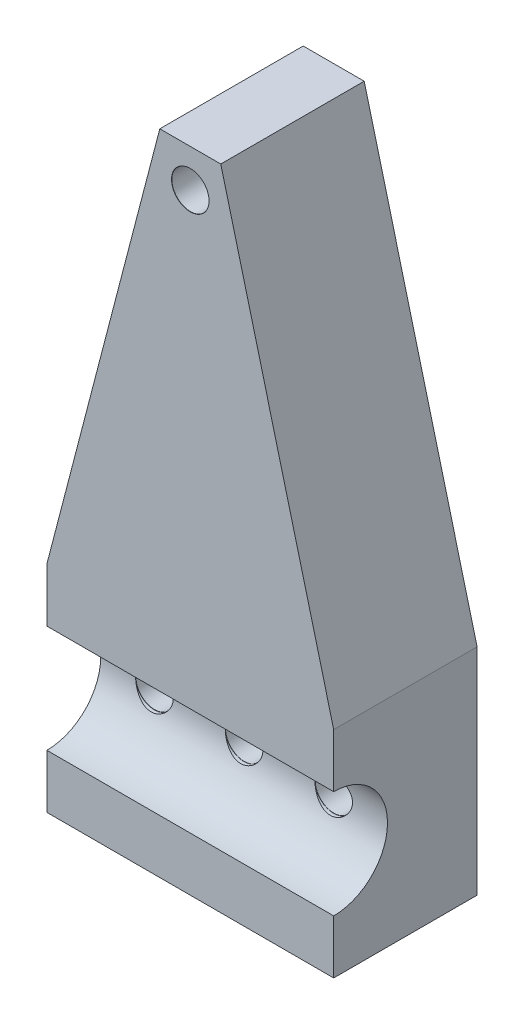
from build123d import *

# Parameters (mm, degrees)
BOSS_EXTRUDE1_DEPTH                      = 25.4
CUT_SWEEP1_PROFILE_R                     = 9.525
M6_CLEARANCE_HOLE1_D                     = 6.6
M6_CLEARANCE_HOLE1_CSINK_D               = 6.65
M6_CLEARANCE_HOLE1_CSINK_ANGLE           = 90
M6_CLEARANCE_HOLE1_ON_FACE_2_D           = 6.6
M6_CLEARANCE_HOLE1_ON_FACE_2_CSINK_D     = 6.65
M6_CLEARANCE_HOLE1_ON_FACE_2_CSINK_ANGLE = 90


with BuildPart() as part:
    # Sketch1 → Boss-Extrude1 (new body)
    with BuildSketch(Plane.XY):
        Polygon((-5.399653784, 95.801105715), (-25.4, 19.05), (-25.4, -19.05), (25.4, -19.05), (25.4, 19.05), (5.399653784, 95.801105715), align=None)
    extrude(amount=BOSS_EXTRUDE1_DEPTH)

    # Cut-Sweep1: sweep along a path in Sketch2
    with BuildLine(Plane.XY.offset(25.4)) as cut_sweep1_path:
        Line((-25.4, 0), (25.4, 0))
    # Cut-Sweep1 profile (on start of the path) → Cut-Sweep1 (sweep, cut)
    with BuildSketch(Plane(origin=(-25.4, 0, 25.4), x_dir=(0, 1, 0), z_dir=(1, 0, 0))):
        Circle(CUT_SWEEP1_PROFILE_R)
    sweep(path=cut_sweep1_path.line, mode=Mode.SUBTRACT)

    # M6 Clearance Hole1 (through all)
    with Locations(Plane(origin=(0, 0, 15.875), x_dir=(0, 1, 0), z_dir=(0, 0, 1))):
        with Locations((0, 0), (0, 15.875), (0, -15.875)):
            CounterSinkHole(M6_CLEARANCE_HOLE1_D / 2, M6_CLEARANCE_HOLE1_CSINK_D / 2, counter_sink_angle=M6_CLEARANCE_HOLE1_CSINK_ANGLE)

    # M6 Clearance Hole1 on face 2 (through all)
    with Locations(Plane(origin=(0, 89.092444953, 25.4), x_dir=(1, 0, 0), z_dir=(0, 0, 1))):
        with Locations((0, 0)):
            CounterSinkHole(M6_CLEARANCE_HOLE1_ON_FACE_2_D / 2, M6_CLEARANCE_HOLE1_ON_FACE_2_CSINK_D / 2, counter_sink_angle=M6_CLEARANCE_HOLE1_ON_FACE_2_CSINK_ANGLE)


solid = part.part
